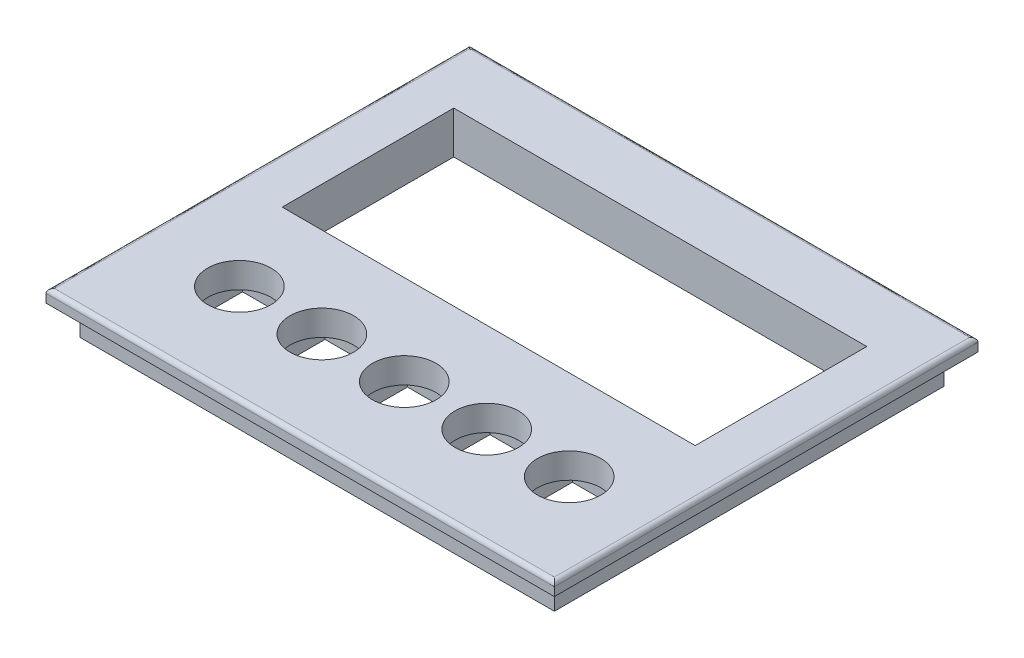
from build123d import *

# Parameters (mm, degrees)
SKETCH1_W           = 120
SKETCH1_H           = 100
BOSS_EXTRUDE1_DEPTH = 10
SKETCH2_W           = 97.5
SKETCH2_H           = 40.5
CUT_EXTRUDE1_DEPTH  = 10
SKETCH3_W           = 120
SKETCH3_H           = 100
SKETCH3_W_2         = 112
SKETCH3_H_2         = 92
CUT_EXTRUDE3_DEPTH  = 7
SKETCH4_W           = 17
SKETCH4_H           = 25
CUT_EXTRUDE4_DEPTH  = 4
SKETCH5_W           = 1
SKETCH5_H           = 25
CUT_EXTRUDE6_DEPTH  = 2.5
SKETCH6_R           = 7.49
CUT_EXTRUDE12_DEPTH = 80.892767694
VARFILLET1_R        = 1


with BuildPart() as part:
    # Sketch1 → Boss-Extrude1 (new body)
    with BuildSketch(Plane(origin=(0, 0, 0), x_dir=(1, 0, 0), z_dir=(0, 1, 0))):
        with Locations((0.311320755, 2.051886792)):
            Rectangle(SKETCH1_W, SKETCH1_H)
    extrude(amount=BOSS_EXTRUDE1_DEPTH)

    # Sketch2 → Cut-Extrude1 (cut)
    with BuildSketch(Plane(origin=(0, 10, 0), x_dir=(1, 0, 0), z_dir=(0, 1, 0))):
        with Locations((0.311320755, 16.801886792)):
            Rectangle(SKETCH2_W, SKETCH2_H)
    extrude(amount=-CUT_EXTRUDE1_DEPTH, mode=Mode.SUBTRACT)

    # Sketch3 → Cut-Extrude3 (cut)
    with BuildSketch(Plane.XZ):
        with Locations((0.311320755, -2.051886792)):
            Rectangle(SKETCH3_W, SKETCH3_H)
        with Locations((0.311320755, -2.051886792)):
            Rectangle(SKETCH3_W_2, SKETCH3_H_2, mode=Mode.SUBTRACT)
    extrude(amount=-CUT_EXTRUDE3_DEPTH, mode=Mode.SUBTRACT)

    # Sketch4 → Cut-Extrude4 (cut)
    with BuildSketch(Plane.XZ):
        with Locations((-37.292172289, 27.948113208)):
            Rectangle(SKETCH4_W, SKETCH4_H)
        with Locations((-17.828799028, 27.948113208)):
            Rectangle(SKETCH4_W, SKETCH4_H)
        with Locations((1.634574233, 27.948113208)):
            Rectangle(SKETCH4_W, SKETCH4_H)
        with Locations((21.097947494, 27.948113208)):
            Rectangle(SKETCH4_W, SKETCH4_H)
        with Locations((40.561320755, 27.948113208)):
            Rectangle(SKETCH4_W, SKETCH4_H)
    extrude(amount=-CUT_EXTRUDE4_DEPTH, mode=Mode.SUBTRACT)

    # Sketch5 → Cut-Extrude6 (cut)
    with BuildSketch(Plane.XZ.offset(-4)):
        with Locations((32.561320755, 27.948113208)):
            Rectangle(SKETCH5_W, SKETCH5_H)
        with Locations((13.097947494, 27.948113208)):
            Rectangle(SKETCH5_W, SKETCH5_H)
        with Locations((-6.365425767, 27.948113208)):
            Rectangle(SKETCH5_W, SKETCH5_H)
        with Locations((-25.828799028, 27.948113208)):
            Rectangle(SKETCH5_W, SKETCH5_H)
        with Locations((-45.292172289, 27.948113208)):
            Rectangle(SKETCH5_W, SKETCH5_H)
    extrude(amount=-CUT_EXTRUDE6_DEPTH, mode=Mode.SUBTRACT)

    # Sketch6 → Cut-Extrude12 (cut, through all)
    with BuildSketch(Plane.XZ.offset(-4)):
        with Locations((40.561320755, 24.698113208)):
            Circle(SKETCH6_R)
        with Locations((21.097947494, 24.698113208)):
            Circle(SKETCH6_R)
        with Locations((1.634574233, 24.698113208)):
            Circle(SKETCH6_R)
        with Locations((-17.828799028, 24.698113208)):
            Circle(SKETCH6_R)
        with Locations((-37.292172289, 24.698113208)):
            Circle(SKETCH6_R)
    extrude(amount=-CUT_EXTRUDE12_DEPTH, mode=Mode.SUBTRACT)

    # VarFillet1
    varfillet1_edges = [part.edges().sort_by_distance(p)[0] for p in [
        (0.311320755, 10, 47.948113208),
        (60.311320755, 10, -2.051886792),
        (0.311320755, 10, -52.051886792),
        (-59.688679245, 10, -2.051886792),
    ]]
    fillet(varfillet1_edges, radius=VARFILLET1_R)


solid = part.part
